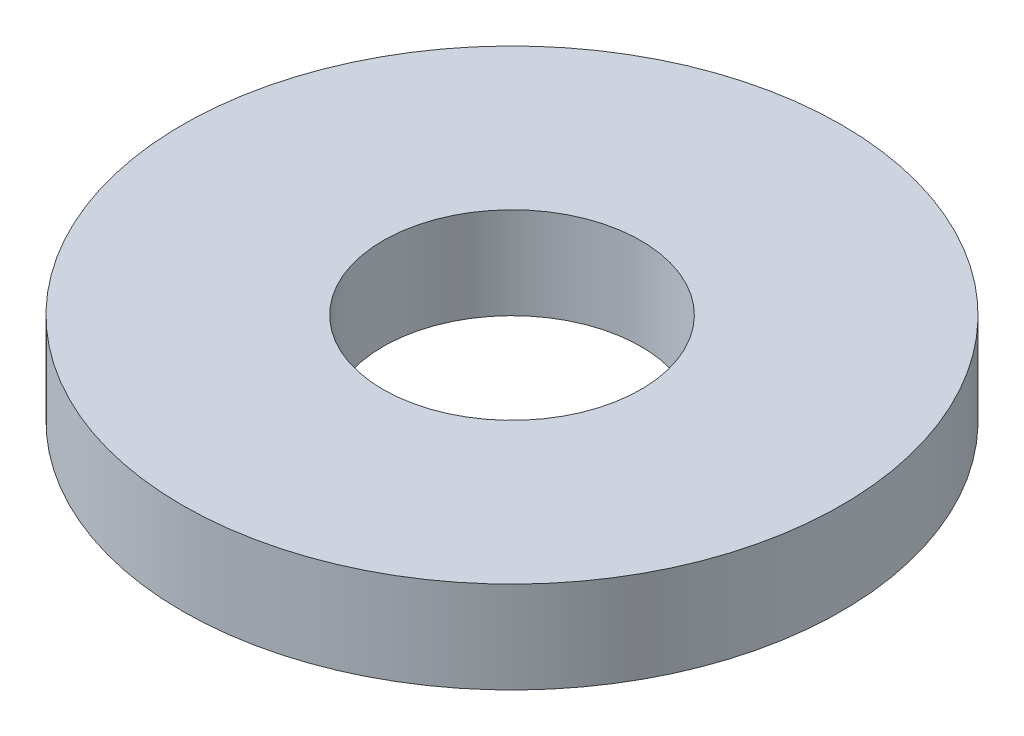
from build123d import *

# Parameters (mm, degrees)
SKETCH1_R           = 57.5
BOSS_EXTRUDE1_DEPTH = 16
SKETCH2_R           = 22.5
CUT_EXTRUDE1_DEPTH  = 83.876414015


with BuildPart() as part:
    # Sketch1 → Boss-Extrude1 (new body)
    with BuildSketch(Plane(origin=(0, 0, 0), x_dir=(1, 0, 0), z_dir=(0, 1, 0))):
        Circle(SKETCH1_R)
    extrude(amount=BOSS_EXTRUDE1_DEPTH)

    # Sketch2 → Cut-Extrude1 (cut, through all)
    with BuildSketch(Plane(origin=(0, 0, 0), x_dir=(1, 0, 0), z_dir=(0, 1, 0))):
        Circle(SKETCH2_R)
    extrude(amount=CUT_EXTRUDE1_DEPTH, mode=Mode.SUBTRACT)


solid = part.part
